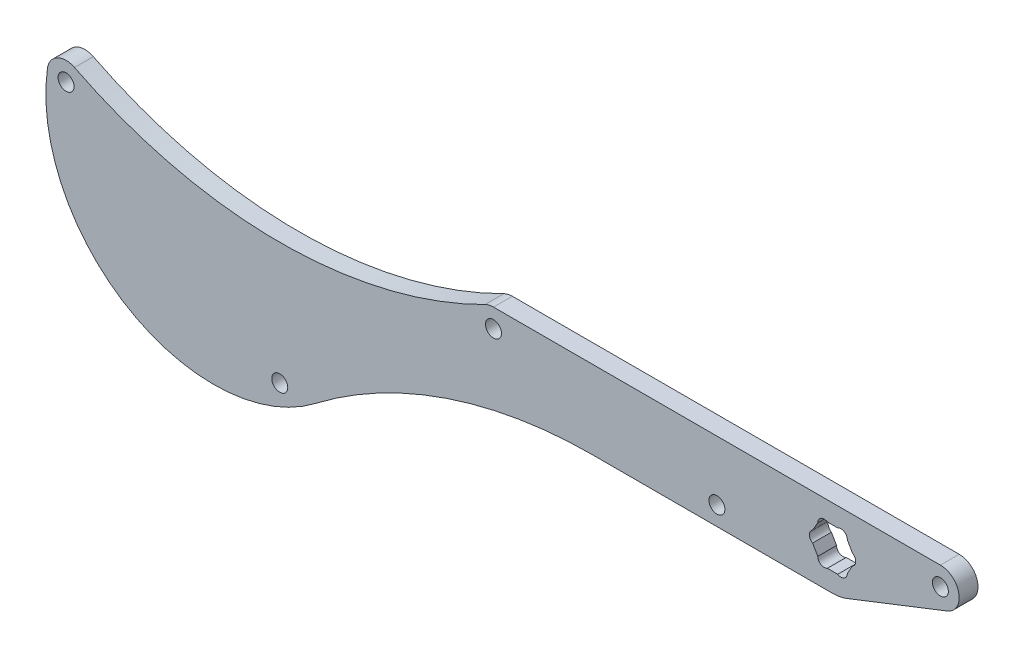
from build123d import *

# Parameters (mm, degrees)
SKETCH4_R           = 2.55
SKETCH4_R_2         = 2.549999993
SKETCH4_R_3         = 6
BOSS_EXTRUDE1_DEPTH = 6
CUT_EXTRUDE1_DEPTH  = 10


with BuildPart() as part:
    # Sketch4 → Boss-Extrude1 (new body)
    with BuildSketch(Plane.XY.offset(-13.5)):
        with BuildLine():
            Line((197.399795586, 12.5), (89.263654418, 12.5))
            ThreePointArc((89.263654418, 12.5), (87.876262264, 12.337391799), (86.564070557, 11.858381004))
            ThreePointArc((86.564070557, 11.858381004), (21.105246497, -3.69943352), (-44.353577564, 11.858381004))
            ThreePointArc((-44.353577564, 11.858381004), (-49.84201029, 11.812468541), (-52.996718657, 7.321052632))
            ThreePointArc((-52.996718657, 7.321052632), (-26.920402355, -46.233558559), (32.526685027, -42.476637828))
            ThreePointArc((32.526685027, -42.476637828), (74.2820165, -20.197808109), (120.978886956, -12.5))
            Line((120.978886956, -12.5), (197.399795586, -12.5))
            ThreePointArc((197.399795586, -12.5), (199.721224158, -12.282547349), (201.961884602, -11.637755102))
            Line((201.961884602, -11.637755102), (233.980730892, 0.913877551))
            ThreePointArc((233.980730892, 0.913877551), (237.686550892, 7.614285714), (231.790928164, 12.5))
            Line((231.790928164, 12.5), (197.399795586, 12.5))
        make_face()
        with Locations((160.527291291, -6.5)):
            Circle(SKETCH4_R, mode=Mode.SUBTRACT)
        with Locations((89.263654418, 6.5)):
            Circle(SKETCH4_R_2, mode=Mode.SUBTRACT)
        with Locations((21.105246497, -42.553713943)):
            Circle(SKETCH4_R_2, mode=Mode.SUBTRACT)
        with Locations((-47.053161424, 6.5)):
            Circle(SKETCH4_R, mode=Mode.SUBTRACT)
        with Locations((197.399795586, 0)):
            Circle(SKETCH4_R_3, mode=Mode.SUBTRACT)
        with Locations((231.790928164, 6.5)):
            Circle(SKETCH4_R, mode=Mode.SUBTRACT)
    extrude(amount=BOSS_EXTRUDE1_DEPTH)

    # Sketch5 → Cut-Extrude1 (cut)
    with BuildSketch(Plane.XY.offset(-7.5)):
        with BuildLine():
            Line((191.03471214, 1.775352078), (192.679753863, 4.624647922))
            ThreePointArc((192.679753863, 4.624647922), (193.704753863, 6.4), (195.754753863, 6.4))
            Line((195.754753863, 6.4), (199.044837309, 6.4))
            ThreePointArc((199.044837309, 6.4), (201.094837309, 6.4), (202.119837309, 4.624647922))
            Line((202.119837309, 4.624647922), (203.764879032, 1.775352078))
            ThreePointArc((203.764879032, 1.775352078), (204.789879032, 0), (203.764879032, -1.775352078))
            Line((203.764879032, -1.775352078), (202.119837309, -4.624647922))
            ThreePointArc((202.119837309, -4.624647922), (201.094837309, -6.4), (199.044837309, -6.4))
            Line((199.044837309, -6.4), (195.754753863, -6.4))
            ThreePointArc((195.754753863, -6.4), (193.704753863, -6.4), (192.679753863, -4.624647922))
            Line((192.679753863, -4.624647922), (191.03471214, -1.775352078))
            ThreePointArc((191.03471214, -1.775352078), (190.00971214, 0), (191.03471214, 1.775352078))
        make_face()
    extrude(amount=-CUT_EXTRUDE1_DEPTH, mode=Mode.SUBTRACT)


solid = part.part
